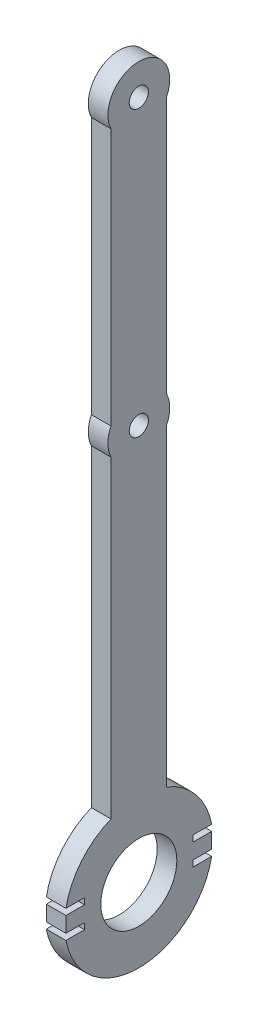
from build123d import *

# Parameters (mm, degrees)
SKETCH1_R           = 1.55
SKETCH1_R_2         = 6.15
BOSS_EXTRUDE3_DEPTH = 3.175


with BuildPart() as part:
    # Sketch1 → Boss-Extrude3 (new body)
    with BuildSketch(Plane(origin=(0, 0, 0), x_dir=(0, 0, -1), z_dir=(1, 0, 0))):
        with BuildLine():
            Line((4.5, -2.179449472), (4.5, -43.820550528))
            ThreePointArc((4.5, -43.820550528), (5, -46), (4.5, -48.179449472))
            Line((4.5, -48.179449472), (4.5, -98.875702269))
            ThreePointArc((4.5, -98.875702269), (9.273958666, -102.384641133), (11.787175234, -107.75))
            Line((11.787175234, -107.75), (8.787175234, -107.75))
            Line((8.787175234, -107.75), (8.787175234, -108.75))
            Line((8.787175234, -108.75), (11.787175234, -108.75))
            Line((11.787175234, -108.75), (11.787175234, -111.25))
            Line((11.787175234, -111.25), (8.787175234, -111.25))
            Line((8.787175234, -111.25), (8.787175234, -112.25))
            Line((8.787175234, -112.25), (11.787175234, -112.25))
            ThreePointArc((11.787175234, -112.25), (0, -122), (-11.787175234, -112.25))
            Line((-11.787175234, -112.25), (-8.787175234, -112.25))
            Line((-8.787175234, -112.25), (-8.787175234, -111.25))
            Line((-8.787175234, -111.25), (-11.787175234, -111.25))
            Line((-11.787175234, -111.25), (-11.787175234, -108.75))
            Line((-11.787175234, -108.75), (-8.787175234, -108.75))
            Line((-8.787175234, -108.75), (-8.787175234, -107.75))
            Line((-8.787175234, -107.75), (-11.787175234, -107.75))
            ThreePointArc((-11.787175234, -107.75), (-9.273958666, -102.384641133), (-4.5, -98.875702269))
            Line((-4.5, -98.875702269), (-4.5, -48.179449472))
            ThreePointArc((-4.5, -48.179449472), (-5, -46), (-4.5, -43.820550528))
            Line((-4.5, -43.820550528), (-4.5, -2.179449472))
            ThreePointArc((-4.5, -2.179449472), (0, 5), (4.5, -2.179449472))
        make_face()
        Circle(SKETCH1_R, mode=Mode.SUBTRACT)
        with Locations((0, -46)):
            Circle(SKETCH1_R, mode=Mode.SUBTRACT)
        with Locations((0, -110)):
            Circle(SKETCH1_R_2, mode=Mode.SUBTRACT)
    extrude(amount=BOSS_EXTRUDE3_DEPTH)


solid = part.part
